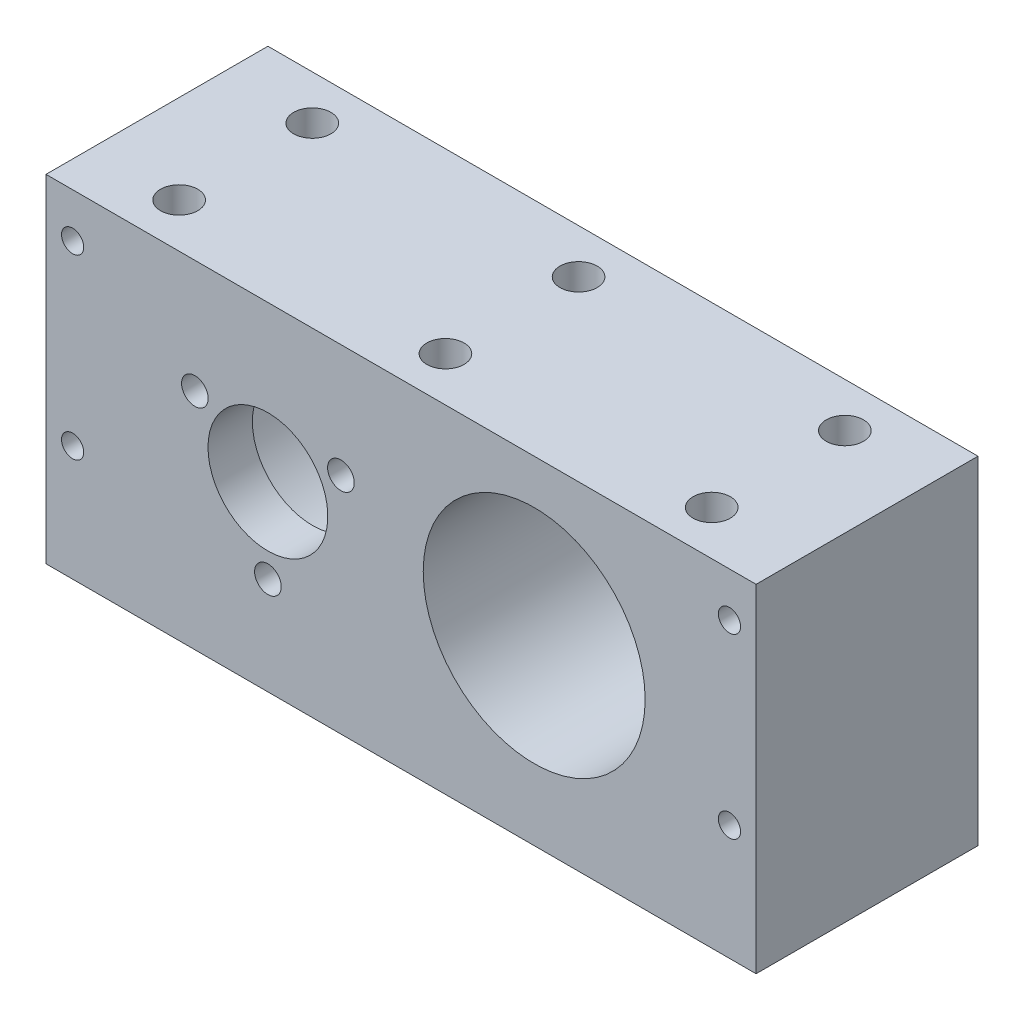
from build123d import *

# Parameters (mm, degrees)
SKETCH_1_W               = 70
SKETCH_1_H               = 35
EXTRUDE_1_DEPTH          = 25
SKETCH_2_R               = 2.1
CUT_EXTRUDE_1_DEPTH      = 10
SKETCH_3_R               = 12.5
CUT_EXTRUDE_2_DEPTH      = 20
SKETCH_5_R               = 6.75
CUT_EXTRUDE_4_DEPTH      = 5
SKETCH_6_R               = 1.5
CUT_EXTRUDE_5_DEPTH      = 5
SKETCH_8_R               = 12.5
CUT_EXTRUDE_6_DEPTH      = 20
SKETCH_9_R               = 6.75
CUT_EXTRUDE_7_DEPTH      = 20
SKETCH_10_R              = 1.5
CUT_EXTRUDE_8_DEPTH      = 44.945989578
SKETCH_11_R              = 3.4
CUT_EXTRUDE_9_DEPTH      = 2
EXTRUDE_START            = 3
SKETCH_13_W              = 70
SKETCH_13_H              = 25
SKETCH_13_R              = 3.4
EXTRUDE_3_DEPTH          = 3
SKETCH_15_W              = 25
SKETCH_15_H              = 38
EXTRUDE_4_DEPTH          = 5
SKETCH_16_W              = 25
SKETCH_16_H              = 38
EXTRUDE_5_DEPTH          = 5
SKETCH_17_R              = 2.1
CUT_EXTRUDE_11_DEPTH     = 61.572270884
SKETCH_18_R              = 1.25
CUT_EXTRUDE_12_DEPTH     = 5
MIRROR_2_COPY_1_SKETCH_R = 1.25
MIRROR_2_COPY_1_DEPTH    = 5
MIRROR_2_COPY_2_SKETCH_R = 1.25
MIRROR_2_COPY_2_DEPTH    = 5


with BuildPart() as part:
    # 草图1 → 凸台-拉伸1 (new body)
    with BuildSketch(Plane.XY):
        Rectangle(SKETCH_1_W, SKETCH_1_H)
    extrude(amount=EXTRUDE_1_DEPTH)

    # 草图2 → 切除-拉伸1 (cut)
    with BuildSketch(Plane(origin=(0, 17.5, 0), x_dir=(1, 0, 0), z_dir=(0, 1, 0))):
        with Locations((30, -5)):
            Circle(SKETCH_2_R)
        with Locations((30, -20)):
            Circle(SKETCH_2_R)
        with Locations((-30, -5)):
            Circle(SKETCH_2_R)
        with Locations((-30, -20)):
            Circle(SKETCH_2_R)
    extrude(amount=-CUT_EXTRUDE_1_DEPTH, mode=Mode.SUBTRACT)

    # 草图3 → 切除-拉伸2 (cut)
    with BuildSketch(Plane(origin=(0, 0, 0), x_dir=(-1, 0, 0), z_dir=(0, 0, -1))):
        with Locations((15, 0)):
            Circle(SKETCH_3_R)
    extrude(amount=-CUT_EXTRUDE_2_DEPTH, mode=Mode.SUBTRACT)

    # 草图5 → 切除-拉伸4 (cut)
    with BuildSketch(Plane(origin=(0, 0, 20), x_dir=(-1, 0, 0), z_dir=(0, 0, -1))):
        with Locations((15, 0)):
            Circle(SKETCH_5_R)
    extrude(amount=-CUT_EXTRUDE_4_DEPTH, mode=Mode.SUBTRACT)

    # 草图6 → 切除-拉伸5 (cut)
    with BuildSketch(Plane(origin=(0, 0, 20), x_dir=(-1, 0, 0), z_dir=(0, 0, -1))):
        with Locations((15, -9.5)):
            Circle(SKETCH_6_R)
        with Locations((6.772758664, 4.75)):
            Circle(SKETCH_6_R)
        with Locations((23.227241336, 4.75)):
            Circle(SKETCH_6_R)
    extrude(amount=-CUT_EXTRUDE_5_DEPTH, mode=Mode.SUBTRACT)

    # 草图8 → 切除-拉伸6 (cut)
    with BuildSketch(Plane.XY.offset(25)):
        with Locations((15, 0)):
            Circle(SKETCH_8_R)
    extrude(amount=-CUT_EXTRUDE_6_DEPTH, mode=Mode.SUBTRACT)

    # 草图9 → 切除-拉伸7 (cut)
    with BuildSketch(Plane.XY.offset(5)):
        with Locations((15, 0)):
            Circle(SKETCH_9_R)
    extrude(amount=-CUT_EXTRUDE_7_DEPTH, mode=Mode.SUBTRACT)

    # 草图10 → 切除-拉伸8 (cut, through all)
    with BuildSketch(Plane.XY.offset(5)):
        with Locations((15, -9.5)):
            Circle(SKETCH_10_R)
        with Locations((6.772758664, 4.75)):
            Circle(SKETCH_10_R)
        with Locations((23.227241336, 4.75)):
            Circle(SKETCH_10_R)
    extrude(amount=-CUT_EXTRUDE_8_DEPTH, mode=Mode.SUBTRACT)

    # 草图11 → 切除-拉伸9 (cut)
    with BuildSketch(Plane.XZ.offset(17.5)):
        with Locations((22, 12.5)):
            Circle(SKETCH_11_R)
        with Locations((-22, 12.5)):
            Circle(SKETCH_11_R)
    extrude(amount=-CUT_EXTRUDE_9_DEPTH, mode=Mode.SUBTRACT)

    # 草图13 → 凸台-拉伸3 (add)
    with BuildSketch(Plane.XZ.offset(17.5).offset(EXTRUDE_START)):
        with Locations((0, 12.5)):
            Rectangle(SKETCH_13_W, SKETCH_13_H)
        with Locations((-22, 12.5)):
            Circle(SKETCH_13_R, mode=Mode.SUBTRACT)
        with Locations((22, 12.5)):
            Circle(SKETCH_13_R, mode=Mode.SUBTRACT)
    extrude(amount=-EXTRUDE_3_DEPTH)

    # 草图15 → 凸台-拉伸4 (add)
    with BuildSketch(Plane.ZY.offset(35)):
        with Locations((12.5, -1.5)):
            Rectangle(SKETCH_15_W, SKETCH_15_H)
    extrude(amount=EXTRUDE_4_DEPTH)

    # 草图16 → 凸台-拉伸5 (add)
    with BuildSketch(Plane(origin=(35, 0, 0), x_dir=(0, 0, -1), z_dir=(1, 0, 0))):
        with Locations((-12.5, -1.5)):
            Rectangle(SKETCH_16_W, SKETCH_16_H)
    extrude(amount=EXTRUDE_5_DEPTH)

    # 草图17 → 切除-拉伸11 (cut, through all)
    with BuildSketch(Plane.XZ.offset(20.5)):
        with Locations((0, 5)):
            Circle(SKETCH_17_R)
        with Locations((0, 20)):
            Circle(SKETCH_17_R)
    extrude(amount=-CUT_EXTRUDE_11_DEPTH, mode=Mode.SUBTRACT)

    # 草图18 → 切除-拉伸12 (cut)
    with BuildSketch(Plane(origin=(0, 0, 0), x_dir=(-1, 0, 0), z_dir=(0, 0, -1))):
        with Locations((-37, 12.5)):
            Circle(SKETCH_18_R)
        with Locations((-37, -7.5)):
            Circle(SKETCH_18_R)
    cut_extrude_12 = extrude(amount=-CUT_EXTRUDE_12_DEPTH, mode=Mode.SUBTRACT)

    # 镜向1: 切除-拉伸12 across plane
    add(cut_extrude_12.mirror(Plane.XY.offset(12.5)), mode=Mode.SUBTRACT)

    # 镜向2 copy 1 sketch → 镜向2 copy 1 (cut)
    with BuildSketch(Plane.XY.offset(25)):
        with Locations((-37, 12.5)):
            Circle(MIRROR_2_COPY_1_SKETCH_R)
        with Locations((-37, -7.5)):
            Circle(MIRROR_2_COPY_1_SKETCH_R)
    extrude(amount=-MIRROR_2_COPY_1_DEPTH, mode=Mode.SUBTRACT)

    # 镜向2 copy 2 sketch → 镜向2 copy 2 (cut)
    with BuildSketch(Plane(origin=(0, 0, 0), x_dir=(1, 0, 0), z_dir=(0, 0, -1))):
        with Locations((-37, -12.5)):
            Circle(MIRROR_2_COPY_2_SKETCH_R)
        with Locations((-37, 7.5)):
            Circle(MIRROR_2_COPY_2_SKETCH_R)
    extrude(amount=-MIRROR_2_COPY_2_DEPTH, mode=Mode.SUBTRACT)


solid = part.part
